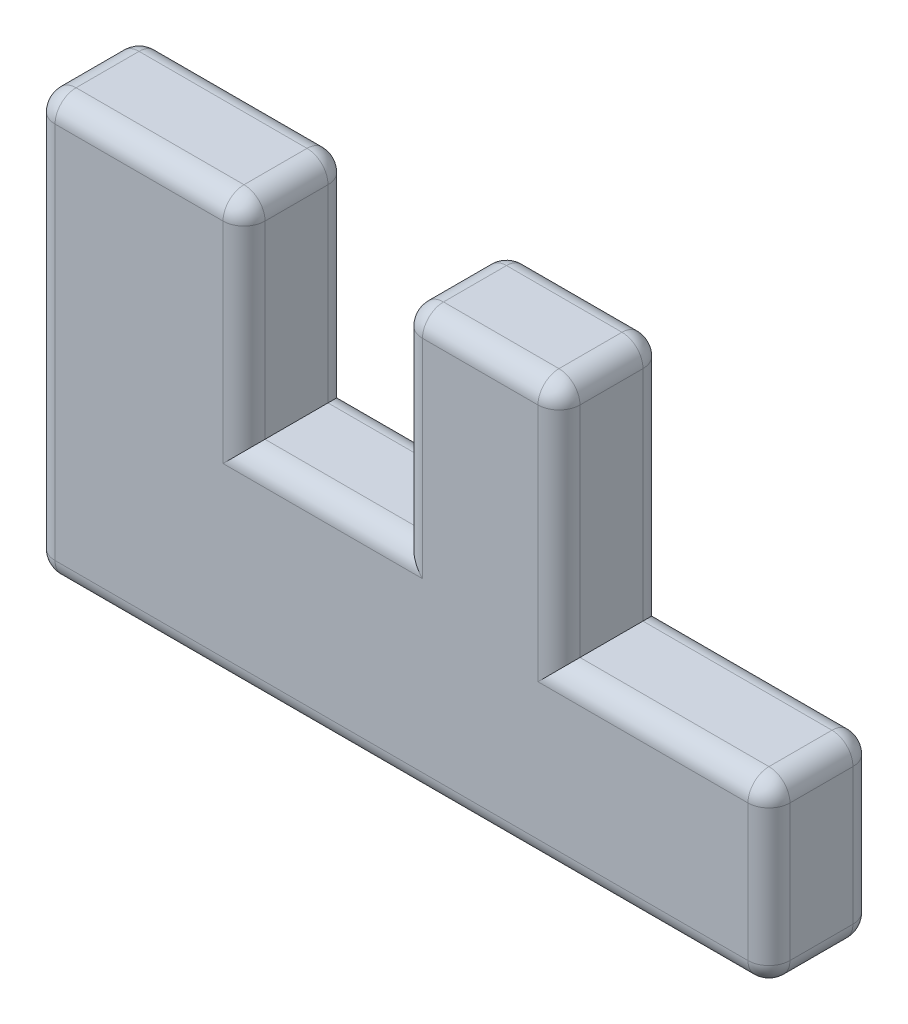
from build123d import *

# Parameters (mm, degrees)
BOSS_EXTRUDE1_DEPTH = 12.7
FILLET1_R           = 2.54
FILLET2_R           = 2.54
FILLET3_R           = 2.54


with BuildPart() as part:
    # Sketch1 → Boss-Extrude1 (new body)
    with BuildSketch(Plane.XY):
        Polygon((-33.315358132, -51.406853933), (55.584641868, -51.406853933), (55.584641868, -29.816853933), (30.184641868, -29.816853933), (30.184641868, -0.823703806), (11.134641868, -0.823703806), (11.134641868, -26.006853933), (-7.915358132, -26.006853933), (-7.915358132, -0.606853933), (-33.315358132, -0.606853933), align=None)
    extrude(amount=BOSS_EXTRUDE1_DEPTH)

    # Fillet1
    fillet1_edges = [part.edges().sort_by_distance(p)[0] for p in [
        (-20.615358132, -0.606853933, 0),
        (20.659641868, -0.823703806, 0),
        (30.184641868, -15.320278869, 0),
        (42.884641868, -29.816853933, 0),
        (55.584641868, -40.611853933, 12.7),
        (55.584641868, -40.611853933, 0),
        (11.134641868, -51.406853933, 0),
        (-33.315358132, -26.006853933, 0),
        (42.884641868, -29.816853933, 12.7),
        (30.184641868, -15.320278869, 12.7),
        (20.659641868, -0.823703806, 12.7),
        (11.134641868, -13.415278869, 12.7),
        (1.609641868, -26.006853933, 12.7),
        (-7.915358132, -13.306853933, 12.7),
        (-20.615358132, -0.606853933, 12.7),
        (-33.315358132, -26.006853933, 12.7),
        (11.134641868, -51.406853933, 12.7),
    ]]
    fillet(fillet1_edges, radius=FILLET1_R)

    # Fillet2
    # the kernel refuses this fillet: 2.54 mm, written as the material it takes off along each edge
    with BuildSketch(Plane(origin=(13.674641868, -3.363703806, 10.16), x_dir=(0, 1, 0), z_dir=(-1, 0, 0))) as fillet2_piece_1_section:
        Polygon((0, 0), (FILLET2_R, 0), (FILLET2_R, -FILLET2_R), (0, -FILLET2_R), align=None)
    fillet2_piece_1 = extrude(amount=FILLET2_R, mode=Mode.PRIVATE)
    fillet2_piece_1 = fillet2_piece_1 - Plane(origin=(13.674641868, -3.363703806, 10.16), x_dir=(0, -0.7071067811865475, -0.7071067811865475), z_dir=(-1, 0, 0)) * Sphere(FILLET2_R, mode=Mode.PRIVATE)
    add(fillet2_piece_1, mode=Mode.SUBTRACT)
    with BuildSketch(Plane(origin=(-10.455358132, -3.146853933, 10.16), x_dir=(1, 0, 0), z_dir=(0, 1, 0))) as fillet2_piece_2_section:
        Polygon((0, 0), (FILLET2_R, 0), (FILLET2_R, -FILLET2_R), (0, -FILLET2_R), align=None)
    fillet2_piece_2 = extrude(amount=FILLET2_R, mode=Mode.PRIVATE)
    fillet2_piece_2 = fillet2_piece_2 - Plane(origin=(-10.455358132, -3.146853933, 10.16), x_dir=(-0.7071067811865475, 0, -0.7071067811865475), z_dir=(0, 1, 0)) * Sphere(FILLET2_R, mode=Mode.PRIVATE)
    add(fillet2_piece_2, mode=Mode.SUBTRACT)
    with BuildSketch(Plane(origin=(-7.915358132, -26.006853933, 0), x_dir=(-1, 0, 0), z_dir=(0, 1, 0))) as fillet2_piece_3:
        with BuildLine():
            CenterArc((FILLET2_R, FILLET2_R), FILLET2_R, 180, 90)
            Line((0, FILLET2_R), (0, 0))
            Line((0, 0), (FILLET2_R, 0))
        make_face()
    extrude(amount=22.86, mode=Mode.SUBTRACT)
    with BuildSketch(Plane(origin=(11.134641868, -26.006853933, 0), x_dir=(0, -1, 0), z_dir=(-1, 0, 0))) as fillet2_piece_4:
        with BuildLine():
            CenterArc((FILLET2_R, FILLET2_R), FILLET2_R, 180, 90)
            Line((0, FILLET2_R), (0, 0))
            Line((0, 0), (FILLET2_R, 0))
        make_face()
    extrude(amount=19.05, mode=Mode.SUBTRACT)
    with BuildSketch(Plane(origin=(-7.915358132, -0.606853933, 2.54), x_dir=(-1, 0, 0), z_dir=(0, 0, 1)), Plane(origin=(11.134641868, -0.823703806, 2.54), x_dir=(0, -1, 0), z_dir=(0, 0, 1))) as fillet2_piece_5:
        with BuildLine():
            CenterArc((FILLET2_R, FILLET2_R), FILLET2_R, 180, 90)
            Line((0, FILLET2_R), (0, 0))
            Line((0, 0), (FILLET2_R, 0))
        make_face()
    extrude(amount=7.62, mode=Mode.SUBTRACT)
    with BuildSketch(Plane(origin=(11.134641868, -3.363703806, 0), x_dir=(1, 0, 0), z_dir=(0, -1, 0))) as fillet2_piece_6:
        with BuildLine():
            CenterArc((FILLET2_R, FILLET2_R), FILLET2_R, 180, 90)
            Line((0, FILLET2_R), (0, 0))
            Line((0, 0), (FILLET2_R, 0))
        make_face()
    extrude(amount=22.643150126, mode=Mode.SUBTRACT)
    with BuildSketch(Plane(origin=(-7.915358132, -3.146853933, 2.54), x_dir=(0, 1, 0), z_dir=(0, 0, 1))) as fillet2_piece_7:
        with BuildLine():
            CenterArc((2.54 - FILLET2_R, FILLET2_R), FILLET2_R, 270, 90)
            Line((2.54, FILLET2_R), (2.54, 0))
            Line((2.54, 0), (2.54 - FILLET2_R, 0))
        make_face()
    revolve(axis=Axis((-7.915358132, -3.146853933, 2.54), (-1, 0, 0)), revolution_arc=90, mode=Mode.SUBTRACT)
    with BuildSketch(Plane(origin=(11.134641868, -3.363703806, 2.54), x_dir=(0, 1, 0), z_dir=(0, 0, 1))) as fillet2_piece_8:
        with BuildLine():
            CenterArc((2.54 - FILLET2_R, -FILLET2_R), FILLET2_R, 0, 90)
            Line((2.54, -FILLET2_R), (2.54, 0))
            Line((2.54, 0), (2.54 - FILLET2_R, 0))
        make_face()
    revolve(axis=Axis((11.134641868, -3.363703806, 2.54), (-1, 0, 0)), revolution_arc=90, mode=Mode.SUBTRACT)
    with BuildSketch(Plane(origin=(11.134641868, -26.006853933, 0), x_dir=(0, -1, 0), z_dir=(-1, 0, 0))) as fillet2_piece_9a_section:
        with BuildLine():
            CenterArc((FILLET2_R, FILLET2_R), FILLET2_R, 180, 90)
            Line((0, FILLET2_R), (0, 0))
            Line((0, 0), (FILLET2_R, 0))
        make_face()
    fillet2_piece_9a = extrude(amount=25.4, mode=Mode.PRIVATE)
    fillet2_piece_9a = split(fillet2_piece_9a, bisect_by=Plane(origin=(-7.915358132, -26.581897523, 0.57504359), z_dir=(-1, 0, 0)), keep=Keep.TOP, mode=Mode.PRIVATE)
    with BuildSketch(Plane(origin=(-7.915358132, -32.356853933, 0), x_dir=(-1, 0, 0), z_dir=(0, 1, 0))) as fillet2_piece_9b_section:
        with BuildLine():
            CenterArc((FILLET2_R, FILLET2_R), FILLET2_R, 180, 90)
            Line((0, FILLET2_R), (0, 0))
            Line((0, 0), (FILLET2_R, 0))
        make_face()
    fillet2_piece_9b = extrude(amount=29.21, mode=Mode.PRIVATE)
    fillet2_piece_9b = split(fillet2_piece_9b, bisect_by=Plane(origin=(-8.490401722, -26.006853933, 0.57504359), z_dir=(0, -1, 0)), keep=Keep.TOP, mode=Mode.PRIVATE)
    fillet2_piece_9 = fillet2_piece_9a & fillet2_piece_9b
    add(fillet2_piece_9, mode=Mode.SUBTRACT)
    with BuildSketch(Plane(origin=(11.134641868, -3.363703806, 0), x_dir=(1, 0, 0), z_dir=(0, -1, 0))) as fillet2_piece_10a_section:
        with BuildLine():
            CenterArc((FILLET2_R, FILLET2_R), FILLET2_R, 180, 90)
            Line((0, FILLET2_R), (0, 0))
            Line((0, 0), (FILLET2_R, 0))
        make_face()
    fillet2_piece_10a = extrude(amount=28.993150126, mode=Mode.PRIVATE)
    fillet2_piece_10a = split(fillet2_piece_10a, bisect_by=Plane(origin=(11.709685459, -26.006853933, 0.57504359), z_dir=(0, -1, 0)), keep=Keep.TOP, mode=Mode.PRIVATE)
    with BuildSketch(Plane(origin=(17.484641868, -26.006853933, 0), x_dir=(0, -1, 0), z_dir=(-1, 0, 0))) as fillet2_piece_10b_section:
        with BuildLine():
            CenterArc((FILLET2_R, FILLET2_R), FILLET2_R, 180, 90)
            Line((0, FILLET2_R), (0, 0))
            Line((0, 0), (FILLET2_R, 0))
        make_face()
    fillet2_piece_10b = extrude(amount=25.4, mode=Mode.PRIVATE)
    fillet2_piece_10b = split(fillet2_piece_10b, bisect_by=Plane(origin=(11.134641868, -26.581897523, 0.57504359), z_dir=(1, 0, 0)), keep=Keep.TOP, mode=Mode.PRIVATE)
    fillet2_piece_10 = fillet2_piece_10a & fillet2_piece_10b
    add(fillet2_piece_10, mode=Mode.SUBTRACT)

    # Fillet3
    # the kernel refuses this fillet: 2.54 mm, written as the material it takes off along each edge
    with BuildSketch(Plane(origin=(27.644641868, -3.363703806, 2.54), x_dir=(0, 1, 0), z_dir=(1, 0, 0))) as fillet3_piece_1_section:
        Polygon((0, 0), (FILLET3_R, 0), (FILLET3_R, -FILLET3_R), (0, -FILLET3_R), align=None)
    fillet3_piece_1 = extrude(amount=FILLET3_R, mode=Mode.PRIVATE)
    fillet3_piece_1 = fillet3_piece_1 - Plane(origin=(27.644641868, -3.363703806, 2.54), x_dir=(0, -0.7071067811865475, 0.7071067811865475), z_dir=(1, 0, 0)) * Sphere(FILLET3_R, mode=Mode.PRIVATE)
    add(fillet3_piece_1, mode=Mode.SUBTRACT)
    with BuildSketch(Plane(origin=(53.044641868, -32.356853933, 2.54), x_dir=(0, 1, 0), z_dir=(1, 0, 0))) as fillet3_piece_2_section:
        Polygon((0, 0), (FILLET3_R, 0), (FILLET3_R, -FILLET3_R), (0, -FILLET3_R), align=None)
    fillet3_piece_2 = extrude(amount=FILLET3_R, mode=Mode.PRIVATE)
    fillet3_piece_2 = fillet3_piece_2 - Plane(origin=(53.044641868, -32.356853933, 2.54), x_dir=(0, -0.7071067811865475, 0.7071067811865475), z_dir=(1, 0, 0)) * Sphere(FILLET3_R, mode=Mode.PRIVATE)
    add(fillet3_piece_2, mode=Mode.SUBTRACT)
    with BuildSketch(Plane(origin=(53.044641868, -48.866853933, 2.54), x_dir=(1, 0, 0), z_dir=(0, -1, 0))) as fillet3_piece_3_section:
        Polygon((0, 0), (FILLET3_R, 0), (FILLET3_R, -FILLET3_R), (0, -FILLET3_R), align=None)
    fillet3_piece_3 = extrude(amount=FILLET3_R, mode=Mode.PRIVATE)
    fillet3_piece_3 = fillet3_piece_3 - Plane(origin=(53.044641868, -48.866853933, 2.54), x_dir=(-0.7071067811865475, 0, 0.7071067811865475), z_dir=(0, -1, 0)) * Sphere(FILLET3_R, mode=Mode.PRIVATE)
    add(fillet3_piece_3, mode=Mode.SUBTRACT)
    with BuildSketch(Plane(origin=(-30.775358132, -48.866853933, 2.54), x_dir=(-1, 0, 0), z_dir=(0, -1, 0))) as fillet3_piece_4_section:
        Polygon((0, 0), (FILLET3_R, 0), (FILLET3_R, FILLET3_R), (0, FILLET3_R), align=None)
    fillet3_piece_4 = extrude(amount=FILLET3_R, mode=Mode.PRIVATE)
    fillet3_piece_4 = fillet3_piece_4 - Plane(origin=(-30.775358132, -48.866853933, 2.54), x_dir=(0.7071067811865475, 0, 0.7071067811865475), z_dir=(0, -1, 0)) * Sphere(FILLET3_R, mode=Mode.PRIVATE)
    add(fillet3_piece_4, mode=Mode.SUBTRACT)
    with BuildSketch(Plane(origin=(-30.775358132, -3.146853933, 2.54), x_dir=(-1, 0, 0), z_dir=(0, 1, 0))) as fillet3_piece_5_section:
        Polygon((0, 0), (FILLET3_R, 0), (FILLET3_R, -FILLET3_R), (0, -FILLET3_R), align=None)
    fillet3_piece_5 = extrude(amount=FILLET3_R, mode=Mode.PRIVATE)
    fillet3_piece_5 = fillet3_piece_5 - Plane(origin=(-30.775358132, -3.146853933, 2.54), x_dir=(0.7071067811865475, 0, 0.7071067811865475), z_dir=(0, 1, 0)) * Sphere(FILLET3_R, mode=Mode.PRIVATE)
    add(fillet3_piece_5, mode=Mode.SUBTRACT)
    with BuildSketch(Plane(origin=(27.644641868, -3.363703806, 10.16), x_dir=(0, 1, 0), z_dir=(1, 0, 0))) as fillet3_piece_6_section:
        Polygon((0, 0), (FILLET3_R, 0), (FILLET3_R, FILLET3_R), (0, FILLET3_R), align=None)
    fillet3_piece_6 = extrude(amount=FILLET3_R, mode=Mode.PRIVATE)
    fillet3_piece_6 = fillet3_piece_6 - Plane(origin=(27.644641868, -3.363703806, 10.16), x_dir=(0, -0.7071067811865475, -0.7071067811865475), z_dir=(1, 0, 0)) * Sphere(FILLET3_R, mode=Mode.PRIVATE)
    add(fillet3_piece_6, mode=Mode.SUBTRACT)
    with BuildSketch(Plane(origin=(53.044641868, -32.356853933, 10.16), x_dir=(0, 1, 0), z_dir=(1, 0, 0))) as fillet3_piece_7_section:
        Polygon((0, 0), (FILLET3_R, 0), (FILLET3_R, FILLET3_R), (0, FILLET3_R), align=None)
    fillet3_piece_7 = extrude(amount=FILLET3_R, mode=Mode.PRIVATE)
    fillet3_piece_7 = fillet3_piece_7 - Plane(origin=(53.044641868, -32.356853933, 10.16), x_dir=(0, -0.7071067811865475, -0.7071067811865475), z_dir=(1, 0, 0)) * Sphere(FILLET3_R, mode=Mode.PRIVATE)
    add(fillet3_piece_7, mode=Mode.SUBTRACT)
    with BuildSketch(Plane(origin=(53.044641868, -48.866853933, 10.16), x_dir=(1, 0, 0), z_dir=(0, -1, 0))) as fillet3_piece_8_section:
        Polygon((0, 0), (FILLET3_R, 0), (FILLET3_R, FILLET3_R), (0, FILLET3_R), align=None)
    fillet3_piece_8 = extrude(amount=FILLET3_R, mode=Mode.PRIVATE)
    fillet3_piece_8 = fillet3_piece_8 - Plane(origin=(53.044641868, -48.866853933, 10.16), x_dir=(-0.7071067811865475, 0, -0.7071067811865475), z_dir=(0, -1, 0)) * Sphere(FILLET3_R, mode=Mode.PRIVATE)
    add(fillet3_piece_8, mode=Mode.SUBTRACT)
    with BuildSketch(Plane(origin=(-30.775358132, -3.146853933, 10.16), x_dir=(-1, 0, 0), z_dir=(0, 1, 0))) as fillet3_piece_9_section:
        Polygon((0, 0), (FILLET3_R, 0), (FILLET3_R, FILLET3_R), (0, FILLET3_R), align=None)
    fillet3_piece_9 = extrude(amount=FILLET3_R, mode=Mode.PRIVATE)
    fillet3_piece_9 = fillet3_piece_9 - Plane(origin=(-30.775358132, -3.146853933, 10.16), x_dir=(0.7071067811865475, 0, -0.7071067811865475), z_dir=(0, 1, 0)) * Sphere(FILLET3_R, mode=Mode.PRIVATE)
    add(fillet3_piece_9, mode=Mode.SUBTRACT)
    with BuildSketch(Plane(origin=(-30.775358132, -48.866853933, 10.16), x_dir=(-1, 0, 0), z_dir=(0, -1, 0))) as fillet3_piece_10_section:
        Polygon((0, 0), (FILLET3_R, 0), (FILLET3_R, -FILLET3_R), (0, -FILLET3_R), align=None)
    fillet3_piece_10 = extrude(amount=FILLET3_R, mode=Mode.PRIVATE)
    fillet3_piece_10 = fillet3_piece_10 - Plane(origin=(-30.775358132, -48.866853933, 10.16), x_dir=(0.7071067811865475, 0, -0.7071067811865475), z_dir=(0, -1, 0)) * Sphere(FILLET3_R, mode=Mode.PRIVATE)
    add(fillet3_piece_10, mode=Mode.SUBTRACT)
    with BuildSketch(Plane(origin=(-33.315358132, -0.606853933, 2.54), x_dir=(1, 0, 0), z_dir=(0, 0, 1)), Plane(origin=(55.584641868, -51.406853933, 2.54), x_dir=(-1, 0, 0), z_dir=(0, 0, 1)), Plane(origin=(55.584641868, -29.816853933, 2.54), x_dir=(0, -1, 0), z_dir=(0, 0, 1)), Plane(origin=(30.184641868, -0.823703806, 2.54), x_dir=(0, -1, 0), z_dir=(0, 0, 1))) as fillet3_piece_11:
        with BuildLine():
            CenterArc((FILLET3_R, -FILLET3_R), FILLET3_R, 90, 90)
            Line((0, -FILLET3_R), (0, 0))
            Line((0, 0), (FILLET3_R, 0))
        make_face()
    extrude(amount=7.62, mode=Mode.SUBTRACT)
    with BuildSketch(Plane(origin=(-33.315358132, -51.406853933, 2.54), x_dir=(1, 0, 0), z_dir=(0, 0, 1))) as fillet3_piece_12:
        with BuildLine():
            CenterArc((FILLET3_R, FILLET3_R), FILLET3_R, 180, 90)
            Line((0, FILLET3_R), (0, 0))
            Line((0, 0), (FILLET3_R, 0))
        make_face()
    extrude(amount=7.62, mode=Mode.SUBTRACT)


solid = part.part
